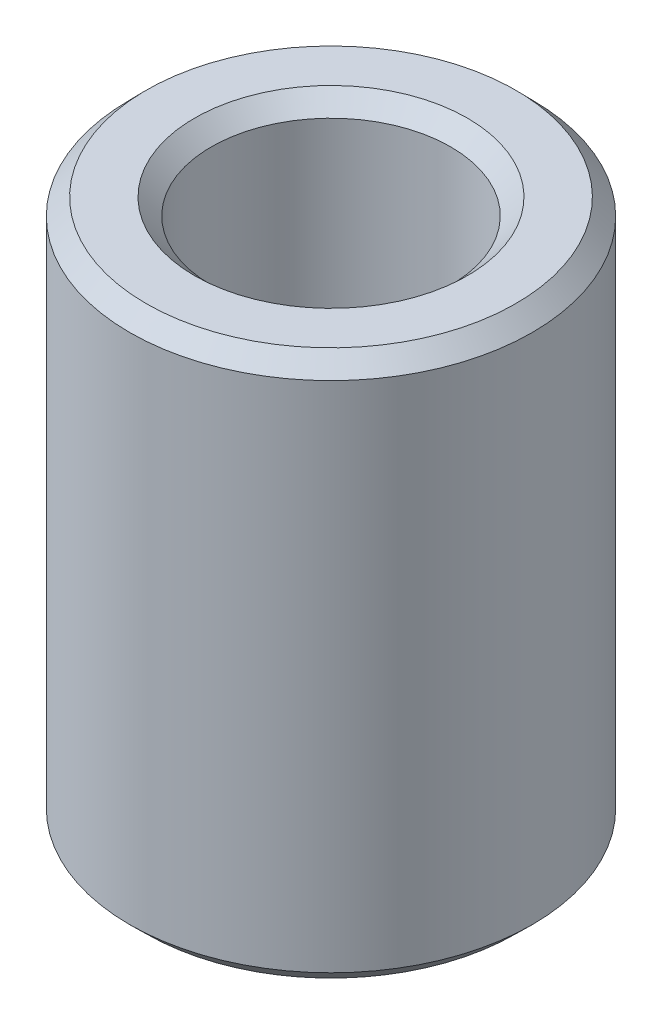
from build123d import *
from OCP.BRepFilletAPI import BRepFilletAPI_MakeChamfer

# Parameters (mm, degrees)
SKETCH1_R           = 12.5
BOSS_EXTRUDE1_DEPTH = 33.907303642
SKETCH2_R           = 7.43361607
CUT_EXTRUDE1_DEPTH  = 39.238792348
CHAMFER1_SIZE       = 1.041349701
CHAMFER1_SIZE2      = 1.022674541


with BuildPart() as part:
    # Sketch1 → Boss-Extrude1 (new body)
    with BuildSketch(Plane(origin=(0, 0, 0), x_dir=(1, 0, 0), z_dir=(0, 1, 0))):
        Circle(SKETCH1_R)
    extrude(amount=BOSS_EXTRUDE1_DEPTH)

    # Sketch2 → Cut-Extrude1 (cut, through all)
    with BuildSketch(Plane(origin=(0, 0, 0), x_dir=(1, 0, 0), z_dir=(0, 1, 0))):
        Circle(SKETCH2_R)
    extrude(amount=CUT_EXTRUDE1_DEPTH, mode=Mode.SUBTRACT)

    # Chamfer1: one chamfer whose edges measure the first distance from different faces: ONE call of the kernel's chamfer builder (chamfer() names one face for all edges)
    chamfer1_edges_1 = [part.edges().sort_by_distance(p)[0] for p in [
        (-7.43361607, 33.907303642, 0),
    ]]
    chamfer1_side_1 = [part.faces().sort_by_distance(p)[0] for p in [
        (-12.146446609, 33.907303642, 0),
    ]]
    chamfer1_edges_2 = [part.edges().sort_by_distance(p)[0] for p in [
        (-7.43361607, 0, 0),
    ]]
    chamfer1_side_2 = [part.faces().sort_by_distance(p)[0] for p in [
        (-7.43361607, 16.953651821, 0),
    ]]
    chamfer1_edges_3 = [part.edges().sort_by_distance(p)[0] for p in [
        (-12.5, 0, 0),
    ]]
    chamfer1_side_3 = [part.faces().sort_by_distance(p)[0] for p in [
        (-12.146446609, 0, 0),
    ]]
    chamfer1_edges_4 = [part.edges().sort_by_distance(p)[0] for p in [
        (-12.5, 33.907303642, 0),
    ]]
    chamfer1_side_4 = [part.faces().sort_by_distance(p)[0] for p in [
        (-12.5, 16.953651821, 0),
    ]]
    chamfer1 = BRepFilletAPI_MakeChamfer(part.part.solid().wrapped)
    for e in chamfer1_edges_1:
        chamfer1.Add(CHAMFER1_SIZE, CHAMFER1_SIZE2, e.wrapped, chamfer1_side_1[0].wrapped)  # the first distance lies on this face
    for e in chamfer1_edges_2:
        chamfer1.Add(CHAMFER1_SIZE, CHAMFER1_SIZE2, e.wrapped, chamfer1_side_2[0].wrapped)  # the first distance lies on this face
    for e in chamfer1_edges_3:
        chamfer1.Add(CHAMFER1_SIZE, CHAMFER1_SIZE2, e.wrapped, chamfer1_side_3[0].wrapped)  # the first distance lies on this face
    for e in chamfer1_edges_4:
        chamfer1.Add(CHAMFER1_SIZE, CHAMFER1_SIZE2, e.wrapped, chamfer1_side_4[0].wrapped)  # the first distance lies on this face
    add(Compound.cast(chamfer1.Shape()), mode=Mode.REPLACE)


solid = part.part
